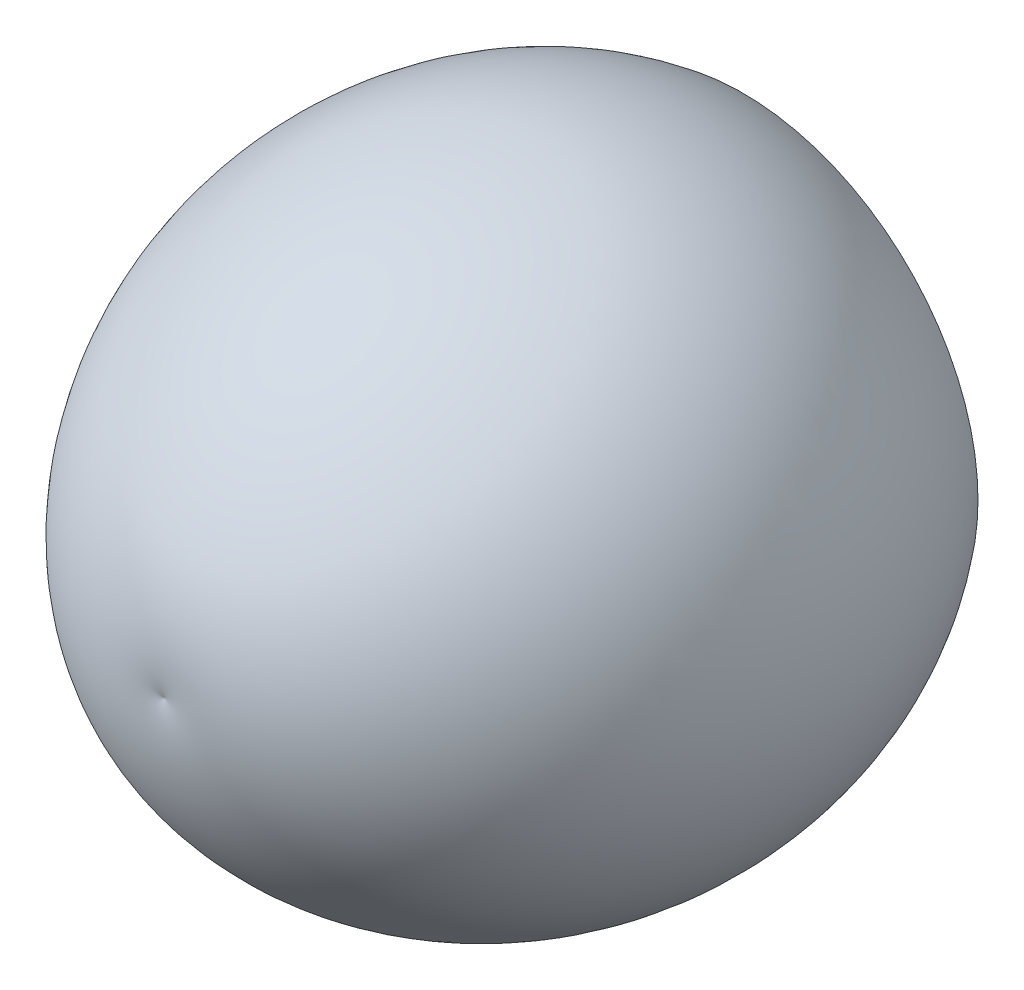
from build123d import *

# Parameters (mm, degrees)
HOLE1_START     = -262.701929072
HOLE1_OUTLINE_R = 80
HOLE1_DEPTH     = 40


# Read off the part's stored shape, not the designer's step: Hole1
with BuildPart() as part:
    # Sketch1 → Revolve1 (revolve)
    with BuildSketch(Plane(origin=(0, 0, 0), x_dir=(1, 0, 0), z_dir=(0, 1, 0))):
        with BuildLine():
            Line((106.696233767, 262.701929072), (0, 262.701929072))
            Line((0, 262.701929072), (0, 0))
            add(Edge.make_bspline(
                [(0, 0), (0.043830976, -0.018679136), (0.131974544, -0.054837862), (0.310227635, -0.122268555), (0.670407337, -0.246977058), (1.17142801, -0.400964353), (1.815615813, -0.574205655), (2.750859904, -0.792416214), (3.888245832, -1.01274692), (5.229195517, -1.218398889), (6.773949318, -1.392849423), (8.72532478, -1.544578317), (11.084284771, -1.62818225), (13.644119342, -1.600154844), (16.398680634, -1.446376571), (19.528153919, -1.15489532), (23.024388255, -0.682393984), (27.07306049, 0.061587258), (32.793677156, 1.422364752), (39.543002431, 3.490898608), (47.224529114, 6.467351474), (57.556292794, 11.436384869), (69.402736969, 18.571028551), (82.296720299, 28.372505494), (95.619918234, 41.279577467), (107.563224067, 55.860947248), (117.827965424, 71.665879724), (126.341324726, 88.477313347), (133.036982052, 106.090936875), (137.252240905, 122.030733415), (139.657409359, 135.946181249), (140.841675986, 147.647372298), (141.291720367, 157.045426617), (141.233130838, 167.630271044), (140.429876368, 179.36735911), (138.941593195, 189.854188374), (137.020196404, 199.065653139), (135.258491665, 205.896350548), (133.955832388, 210.41516403), (132.525161651, 214.895091141), (130.966717722, 219.332220248), (129.280902335, 223.722506087), (127.694710364, 227.51955736), (126.256215149, 230.739744238), (124.75469901, 233.931037787), (123.451366323, 236.565139378), (122.095661561, 239.173327922), (120.407390083, 242.26913684), (118.656323389, 245.33191257), (116.830397081, 248.347471588), (114.925598842, 251.319153062), (113.292165698, 253.75734764), (112.115819327, 255.454750298), (111.101943835, 256.880227694), (110.202837031, 258.114214129), (109.493385846, 259.0756771), (108.670260495, 260.164838088), (107.969459905, 261.083221773), (107.245854497, 262.007379495), (106.881328517, 262.469058983), (106.696233767, 262.701929072)],
                knots=[0, 0, 0, 0, 0, 0.000496676, 0.000993352, 0.001986704, 0.003973409, 0.005960113, 0.007946817, 0.011997925, 0.016049033, 0.020100141, 0.024151249, 0.032400789, 0.040650329, 0.04677887, 0.052907411, 0.065164493, 0.077420581, 0.089676669, 0.114189812, 0.138702405, 0.163215231, 0.209093252, 0.258118854, 0.307144114, 0.356169608, 0.405195108, 0.454220504, 0.503245934, 0.552271368, 0.576784106, 0.601296843, 0.62580956, 0.650322278, 0.687091361, 0.723860441, 0.7361168, 0.748373159, 0.760629519, 0.77288588, 0.785142241, 0.797398601, 0.80965496, 0.815783139, 0.821911318, 0.834167677, 0.840295856, 0.846424035, 0.858680391, 0.870936747, 0.877064925, 0.883193103, 0.889321281, 0.89238537, 0.895449458, 0.898861033, 0.902272608, 0.905684183, 0.909095758, 0.909095758, 0.909095758, 0.909095758, 0.909095758], degree=4))
        make_face()
    revolve(axis=Axis((0, 0, 737.298070928), (0, 0, -1)))

    # Hole1 outline → Hole1 (cut)
    with BuildSketch(Plane.XY.offset(HOLE1_START)):
        Circle(HOLE1_OUTLINE_R)
    extrude(amount=HOLE1_DEPTH, mode=Mode.SUBTRACT)


solid = part.part
